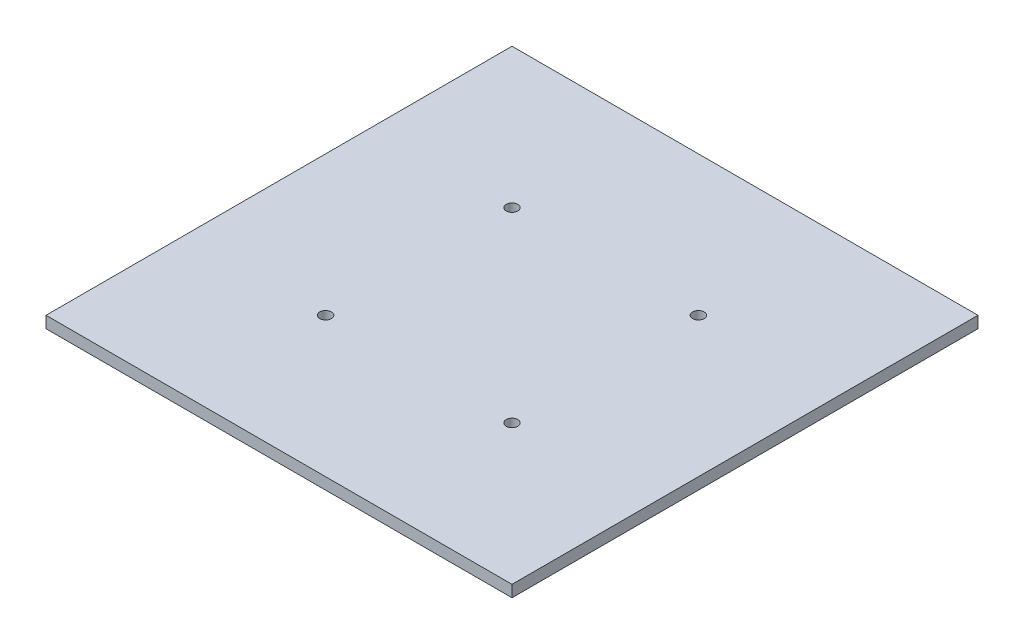
from build123d import *

# Parameters (mm, degrees)
SKETCH1_W           = 127
SKETCH1_H           = 127
SKETCH1_R           = 1.5875
BOSS_EXTRUDE1_DEPTH = 3.175


with BuildPart() as part:
    # Sketch1 → Boss-Extrude1 (new body)
    with BuildSketch(Plane(origin=(0, 0, 0), x_dir=(1, 0, 0), z_dir=(0, 1, 0))):
        with Locations((63.5, 63.5)):
            Rectangle(SKETCH1_W, SKETCH1_H)
        with Locations((38.1, 88.9)):
            Circle(SKETCH1_R, mode=Mode.SUBTRACT)
        with Locations((88.9, 88.9)):
            Circle(SKETCH1_R, mode=Mode.SUBTRACT)
        with Locations((38.1, 38.1)):
            Circle(SKETCH1_R, mode=Mode.SUBTRACT)
        with Locations((88.9, 38.1)):
            Circle(SKETCH1_R, mode=Mode.SUBTRACT)
    extrude(amount=BOSS_EXTRUDE1_DEPTH)


solid = part.part
